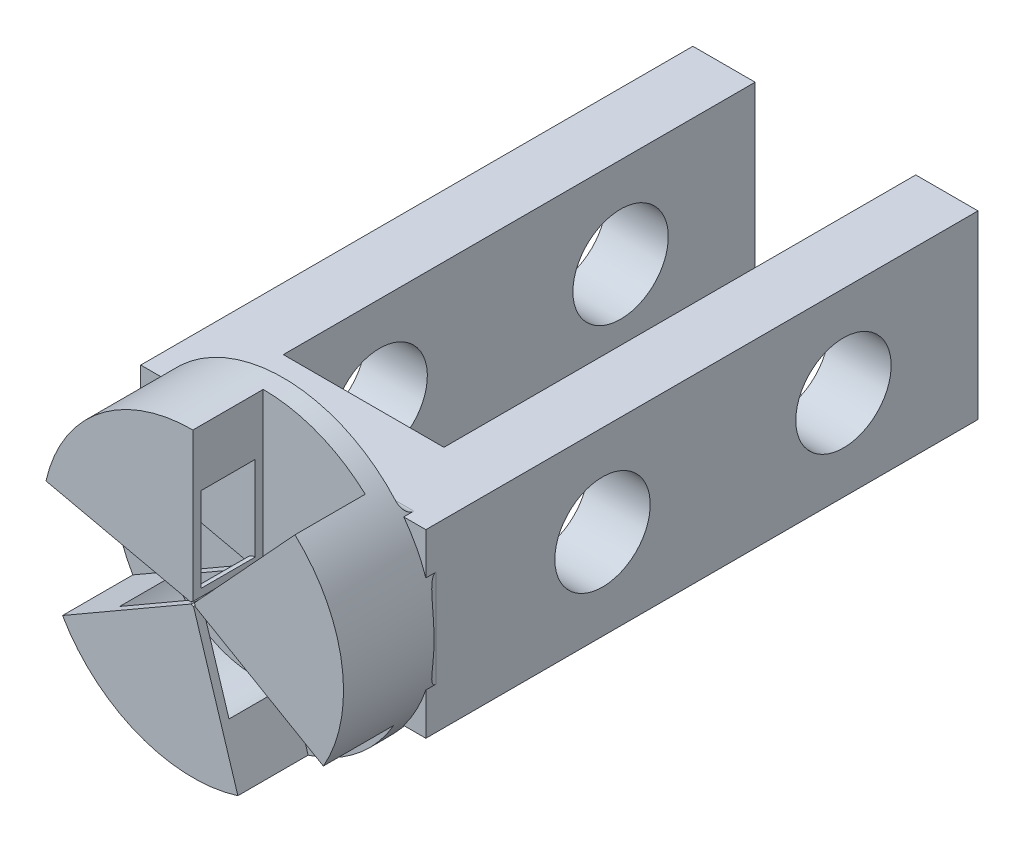
from build123d import *
from build123d.topology import SkipClean

# Parameters (mm, degrees)
ESQUISSE1_W             = 14.2
ESQUISSE1_H             = 9
BOSS_EXTRU_3_DEPTH      = 4
ESQUISSE4_W             = 3.1
ESQUISSE4_H             = 9
BOSS_EXTRU_4_DEPTH      = 23.5
ESQUISSE5_R             = 2.375
ENL_V_MAT_EXTRU_2_DEPTH = 28.823371471
ESQUISSE6_R             = 7.5
BOSS_EXTRU_5_DEPTH      = 1
CONG_1_R                = 0.5
EXTRU_MINCE1_DEPTH      = 3.5
ESQUISSE10_R            = 0.5
ESQUISSE10_W            = 4.21226809
ESQUISSE10_H            = 2.7


with BuildPart() as part:
    # Esquisse1 → Boss.-Extru.3 (new body)
    with BuildSketch(Plane.XY):
        Rectangle(ESQUISSE1_W, ESQUISSE1_H)
    extrude(amount=BOSS_EXTRU_3_DEPTH)

    # Esquisse4 → Boss.-Extru.4 (add)
    with BuildSketch(Plane(origin=(0, 0, 0), x_dir=(-1, 0, 0), z_dir=(0, 0, -1))):
        with Locations((5.55, 0)):
            Rectangle(ESQUISSE4_W, ESQUISSE4_H)
        with Locations((-5.55, 0)):
            Rectangle(ESQUISSE4_W, ESQUISSE4_H)
    extrude(amount=BOSS_EXTRU_4_DEPTH)

    # Esquisse5 → Enlèv. mat.-Extru.2 (cut, through all)
    with BuildSketch(Plane.ZY.offset(7.1)):
        with Locations((-16.8, 0)):
            Circle(ESQUISSE5_R)
        with Locations((-4.8, 0)):
            Circle(ESQUISSE5_R)
    extrude(amount=-ENL_V_MAT_EXTRU_2_DEPTH, mode=Mode.SUBTRACT)

    # Esquisse6 → Boss.-Extru.5 (add)
    with BuildSketch(Plane.XY.offset(4)):
        with Locations(Location((0, 0, 0), (0, 0, 161.203094965))):
            Circle(ESQUISSE6_R)
    extrude(amount=BOSS_EXTRU_5_DEPTH)

    # Congé1
    # the kernel refuses this fillet: 0.5 mm, written as the material it adds along each edge
    with BuildSketch(Plane(origin=(-7.1, -3.666609195, 4), x_dir=(0, 0, -1), z_dir=(0, 1, 0))) as cong_1_piece_1_section:
        with BuildLine():
            CenterArc((CONG_1_R, CONG_1_R), CONG_1_R, 180, 90)
            Line((0, CONG_1_R), (0, 0))
            Line((0, 0), (CONG_1_R, 0))
        make_face()
    cong_1_piece_1 = extrude(amount=7.333218389, mode=Mode.PRIVATE)
    cong_1_piece_1 = cong_1_piece_1 & Plane(origin=(0, 0, 3.878104255), x_dir=(-0.946666666666828, 0.3222145592953816, 0), z_dir=(0, 0, -1)) * Cylinder(7.5, 17, mode=Mode.PRIVATE)
    add(cong_1_piece_1)
    with BuildSketch(Plane(origin=(7.25, -4.5, 4), x_dir=(0, 0, -1), z_dir=(-1, 0, 0))) as cong_1_piece_2_section:
        with BuildLine():
            CenterArc((CONG_1_R, CONG_1_R), CONG_1_R, 180, 90)
            Line((0, CONG_1_R), (0, 0))
            Line((0, 0), (CONG_1_R, 0))
        make_face()
    cong_1_piece_2 = extrude(amount=14.5, mode=Mode.PRIVATE)
    cong_1_piece_2 = cong_1_piece_2 & Plane(origin=(0, 0, 3.887627019), x_dir=(-0.946666666666828, 0.3222145592953816, 0), z_dir=(0, 0, -1)) * Cylinder(7.5, 32, mode=Mode.PRIVATE)
    add(cong_1_piece_2)
    with BuildSketch(Plane(origin=(7.1, 3.666609195, 4), x_dir=(0, 0, -1), z_dir=(0, -1, 0))) as cong_1_piece_3_section:
        with BuildLine():
            CenterArc((CONG_1_R, CONG_1_R), CONG_1_R, 180, 90)
            Line((0, CONG_1_R), (0, 0))
            Line((0, 0), (CONG_1_R, 0))
        make_face()
    cong_1_piece_3 = extrude(amount=7.333218389, mode=Mode.PRIVATE)
    cong_1_piece_3 = cong_1_piece_3 & Plane(origin=(0, 0, 3.87809802), x_dir=(-0.946666666666828, 0.3222145592953816, 0), z_dir=(0, 0, -1)) * Cylinder(7.5, 17, mode=Mode.PRIVATE)
    add(cong_1_piece_3)
    with BuildSketch(Plane(origin=(-7.25, 4.5, 4), x_dir=(0, 0, -1), z_dir=(1, 0, 0))) as cong_1_piece_4_section:
        with BuildLine():
            CenterArc((CONG_1_R, CONG_1_R), CONG_1_R, 180, 90)
            Line((0, CONG_1_R), (0, 0))
            Line((0, 0), (CONG_1_R, 0))
        make_face()
    cong_1_piece_4 = extrude(amount=14.5, mode=Mode.PRIVATE)
    cong_1_piece_4 = cong_1_piece_4 & Plane(origin=(0, 0, 3.88762702), x_dir=(-0.946666666666828, 0.3222145592953816, 0), z_dir=(0, 0, -1)) * Cylinder(7.5, 32, mode=Mode.PRIVATE)
    add(cong_1_piece_4)

    # Esquisse8 → Extru.-Mince1 (add)
    with SkipClean():  # the faces are left unmerged after this step: merging them gives an invalid solid
        with BuildSketch(Plane.XY.offset(5)):
            with BuildLine():
                ThreePointArc((5.080001443, 5.517570601), (7.414056481, 1.132151268), (6.495190528, -3.75))
                Line((6.495190528, -3.75), (0.08660254, -0.05))
                ThreePointArc((0.08660254, -0.05), (0.098854086, 0.01509535), (0.067733353, 0.073567608))
                Line((0.067733353, 0.073567608), (5.080001443, 5.517570601))
            make_face()
            with BuildLine():
                ThreePointArc((2.238355587, -7.158195601), (-2.726556481, -6.986836892), (-6.495190528, -3.75))
                Line((-6.495190528, -3.75), (-0.08660254, -0.05))
                ThreePointArc((-0.08660254, -0.05), (-0.036354086, -0.093157825), (0.029844741, -0.095442608))
                Line((0.029844741, -0.095442608), (2.238355587, -7.158195601))
            make_face()
            with BuildLine():
                ThreePointArc((-7.318357029, 1.640625), (-4.6875, 5.854685623), (0, 7.5))
                Line((0, 7.5), (0, 0.1))
                ThreePointArc((0, 0.1), (-0.0625, 0.078062475), (-0.097578094, 0.021875))
                Line((-0.097578094, 0.021875), (-7.318357029, 1.640625))
            make_face()
        extrude(amount=EXTRU_MINCE1_DEPTH)
    add(part.part.scale(1), mode=Mode.REPLACE)  # the faces are merged on a copy

    # Esquisse10 → Enlèvement de matière-Révolution1 (revolve, cut)
    with BuildSketch(Plane(origin=(0, 0, 0), x_dir=(1, 0, 0), z_dir=(0, 1, 0)), mode=Mode.PRIVATE) as enl_vement_de_mati_re_r_volution1_sk:
        with Locations((-4, -6.75)):
            Circle(ESQUISSE10_R)
        with Locations((2.573867398, -6.75)):
            Rectangle(ESQUISSE10_W, ESQUISSE10_H)
    revolve(enl_vement_de_mati_re_r_volution1_sk.sketch.rotate(Axis((0, 0, 2.6), (0, 0, 1)), 347.364374907), axis=Axis((0, 0, 2.6), (0, 0, 1)), mode=Mode.SUBTRACT)


solid = part.part
